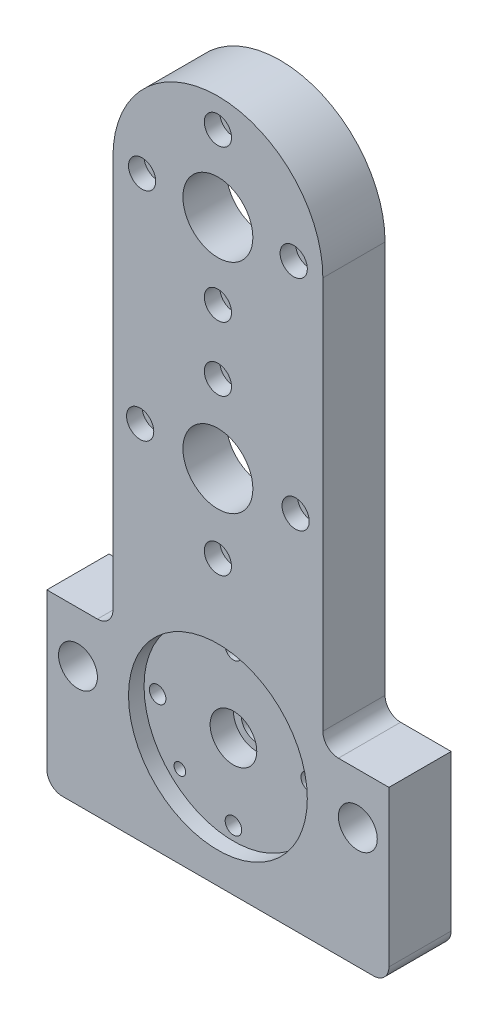
from build123d import *

# Parameters (mm, degrees)
BOLT_CIRCLE_R                                     = 14.2748
BOLT_CIRCLE_R_2                                   = 6.35
BASE_DEPTH                                        = 12.7
STRUCTURE_TUBE_CONNECTION_COUNTERBORE_D           = 6.7564
STRUCTURE_TUBE_CONNECTION_COUNTERBORE_CBORE_D     = 11.1125
STRUCTURE_TUBE_CONNECTION_COUNTERBORE_CBORE_DEPTH = 6.35
STRUCTURE_TUBE_CONNECTION_COUNTERBORE_PA_COUNT    = 4
SPINDLE_CONNECTION_COUNTERBORE_D                  = 6.7564
SPINDLE_CONNECTION_COUNTERBORE_CBORE_D            = 11.1125
SPINDLE_CONNECTION_COUNTERBORE_CBORE_DEPTH        = 6.35
SPINDLE_CONNECTION_COUNTERBORE_PATTERN_COUNT      = 4
SKETCH16_R                                        = 36.5125
STRUCTURE_TUBE_MOUNTING_POCKET_DEPTH              = 6.35
SKETCH17_R                                        = 36.5125
SPINDLE_MOUNTING_POCKET_DEPTH                     = 7.62
SKETCH18_R                                        = 9.525
LEAD_SCREW_THROUGH_HOLE_DEPTH                     = 9.525
SKETCH20_R                                        = 7.9375
RAIL_MOUNTING_PILOT_HOLES_DEPTH                   = 166.290695159
SKETCH27_R                                        = 2.38125
ALIGNMENT_FEATURES_DEPTH                          = 6.35
GENERIC_ROUNDING_FILLET_R                         = 6.35
WOOD_SPINDLE_CBORE_D                              = 6.7564
WOOD_SPINDLE_CBORE_CBORE_D                        = 11.1125
WOOD_SPINDLE_CBORE_CBORE_DEPTH                    = 6.35
CIRPATTERN1_COUNT                                 = 4
SKETCH30_R                                        = 36.5125
CUT_EXTRUDE1_DEPTH                                = 7.62


with BuildPart() as part:
    # Bolt circle → Base (new, symmetric)
    with BuildSketch(Plane.XY):
        with BuildLine():
            Line((-42.8625, 88.9), (-42.8625, -77.7875))
            Line((-42.8625, -77.7875), (-69.85, -77.7875))
            Line((-69.85, -77.7875), (-69.85, -147.6375))
            Line((-69.85, -147.6375), (69.85, -147.6375))
            Line((69.85, -147.6375), (69.85, -77.7875))
            Line((69.85, -77.7875), (42.8625, -77.7875))
            Line((42.8625, -77.7875), (42.8625, 88.9))
            ThreePointArc((42.8625, 88.9), (0, 131.7625), (-42.8625, 88.9))
        make_face()
        with Locations((0, 88.9)):
            Circle(BOLT_CIRCLE_R, mode=Mode.SUBTRACT)
        Circle(BOLT_CIRCLE_R, mode=Mode.SUBTRACT)
        with Locations((0, -98.425)):
            Circle(BOLT_CIRCLE_R_2, mode=Mode.SUBTRACT)
    extrude(amount=BASE_DEPTH, both=True)

    # Structure tube connection counterbore (through all)
    with Locations(Plane(origin=(0, 0, -12.7), x_dir=(-1, 0, 0), z_dir=(0, 0, -1))):
        with Locations((0, -67.46875)):
            structure_tube_connection_counterbore = CounterBoreHole(STRUCTURE_TUBE_CONNECTION_COUNTERBORE_D / 2, STRUCTURE_TUBE_CONNECTION_COUNTERBORE_CBORE_D / 2, STRUCTURE_TUBE_CONNECTION_COUNTERBORE_CBORE_DEPTH)

    # Structure tube connection counterbore pattern: Structure tube connection counterbore ×4 about axis
    structure_tube_connection_counterbore_pa_axis = Axis((0, -98.425, 12.7), (0, 0, -1))
    for i in range(1, STRUCTURE_TUBE_CONNECTION_COUNTERBORE_PA_COUNT):
        add(structure_tube_connection_counterbore.rotate(structure_tube_connection_counterbore_pa_axis, i * 360 / STRUCTURE_TUBE_CONNECTION_COUNTERBORE_PA_COUNT), mode=Mode.SUBTRACT)

    # Spindle connection counterbore (through all)
    with Locations(Plane.XY.offset(12.7)):
        with Locations((0, 31.75)):
            spindle_connection_counterbore = CounterBoreHole(SPINDLE_CONNECTION_COUNTERBORE_D / 2, SPINDLE_CONNECTION_COUNTERBORE_CBORE_D / 2, SPINDLE_CONNECTION_COUNTERBORE_CBORE_DEPTH)

    # Spindle connection counterbore pattern: Spindle connection counterbore ×4 about axis
    spindle_connection_counterbore_pattern_axis = Axis((0, 0, 12.7), (0, 0, -1))
    for i in range(1, SPINDLE_CONNECTION_COUNTERBORE_PATTERN_COUNT):
        add(spindle_connection_counterbore.rotate(spindle_connection_counterbore_pattern_axis, i * 360 / SPINDLE_CONNECTION_COUNTERBORE_PATTERN_COUNT), mode=Mode.SUBTRACT)

    # Sketch16 → Structure tube mounting pocket (cut)
    with BuildSketch(Plane.XY.offset(12.7)):
        with Locations((0, -98.425)):
            Circle(SKETCH16_R)
    extrude(amount=-STRUCTURE_TUBE_MOUNTING_POCKET_DEPTH, mode=Mode.SUBTRACT)

    # Sketch17 → Spindle mounting pocket (cut)
    with BuildSketch(Plane(origin=(0, 0, -12.7), x_dir=(-1, 0, 0), z_dir=(0, 0, -1))):
        Circle(SKETCH17_R)
    extrude(amount=-SPINDLE_MOUNTING_POCKET_DEPTH, mode=Mode.SUBTRACT)

    # Sketch18 → Lead screw through hole (cut)
    with BuildSketch(Plane.XY.offset(6.35)):
        with Locations((0, -98.425)):
            Circle(SKETCH18_R)
    extrude(amount=-LEAD_SCREW_THROUGH_HOLE_DEPTH, mode=Mode.SUBTRACT)

    # Sketch20 → Rail mounting pilot_holes (cut, through all)
    with BuildSketch(Plane.XY.offset(12.7)):
        with Locations((57.15, -98.425)):
            Circle(SKETCH20_R)
        with Locations((-57.15, -98.425)):
            Circle(SKETCH20_R)
    extrude(amount=-RAIL_MOUNTING_PILOT_HOLES_DEPTH, mode=Mode.SUBTRACT)

    # Sketch27 → Alignment_features (cut)
    with BuildSketch(Plane.XY.offset(6.35)):
        with Locations((-21.889374295, -120.314374295)):
            Circle(SKETCH27_R)
        with BuildLine():
            Line((20.681324246, -74.335397148), (19.602797121, -75.500272889))
            ThreePointArc((19.602797121, -75.500272889), (19.732320046, -78.865377187), (23.097424344, -78.735854262))
            Line((23.097424344, -78.735854262), (24.175951469, -77.570978521))
            ThreePointArc((24.175951469, -77.570978521), (24.046428544, -74.205874223), (20.681324246, -74.335397148))
        make_face()
    extrude(amount=-ALIGNMENT_FEATURES_DEPTH, mode=Mode.SUBTRACT)

    # Generic_rounding_fillet
    generic_rounding_fillet_edges = [part.edges().sort_by_distance(p)[0] for p in [
        (42.8625, -77.7875, 0),
        (-42.8625, -77.7875, 0),
        (-69.85, -147.6375, 0),
        (69.85, -147.6375, 0),
    ]]
    fillet(generic_rounding_fillet_edges, radius=GENERIC_ROUNDING_FILLET_R)

    # wood_spindle_CBORE (through all)
    with Locations(Plane.XY.offset(12.7)):
        with Locations((0, 119.85625)):
            wood_spindle_cbore = CounterBoreHole(WOOD_SPINDLE_CBORE_D / 2, WOOD_SPINDLE_CBORE_CBORE_D / 2, WOOD_SPINDLE_CBORE_CBORE_DEPTH)

    # CirPattern1: wood_spindle_CBORE ×4 about axis
    cirpattern1_axis = Axis((0, 88.9, 12.7), (0, 0, -1))
    for i in range(1, CIRPATTERN1_COUNT):
        add(wood_spindle_cbore.rotate(cirpattern1_axis, i * 360 / CIRPATTERN1_COUNT), mode=Mode.SUBTRACT)

    # Sketch30 → Cut-Extrude1 (cut)
    with BuildSketch(Plane(origin=(0, 0, -12.7), x_dir=(-1, 0, 0), z_dir=(0, 0, -1))):
        with Locations((0, 88.9)):
            Circle(SKETCH30_R)
    extrude(amount=-CUT_EXTRUDE1_DEPTH, mode=Mode.SUBTRACT)


solid = part.part
